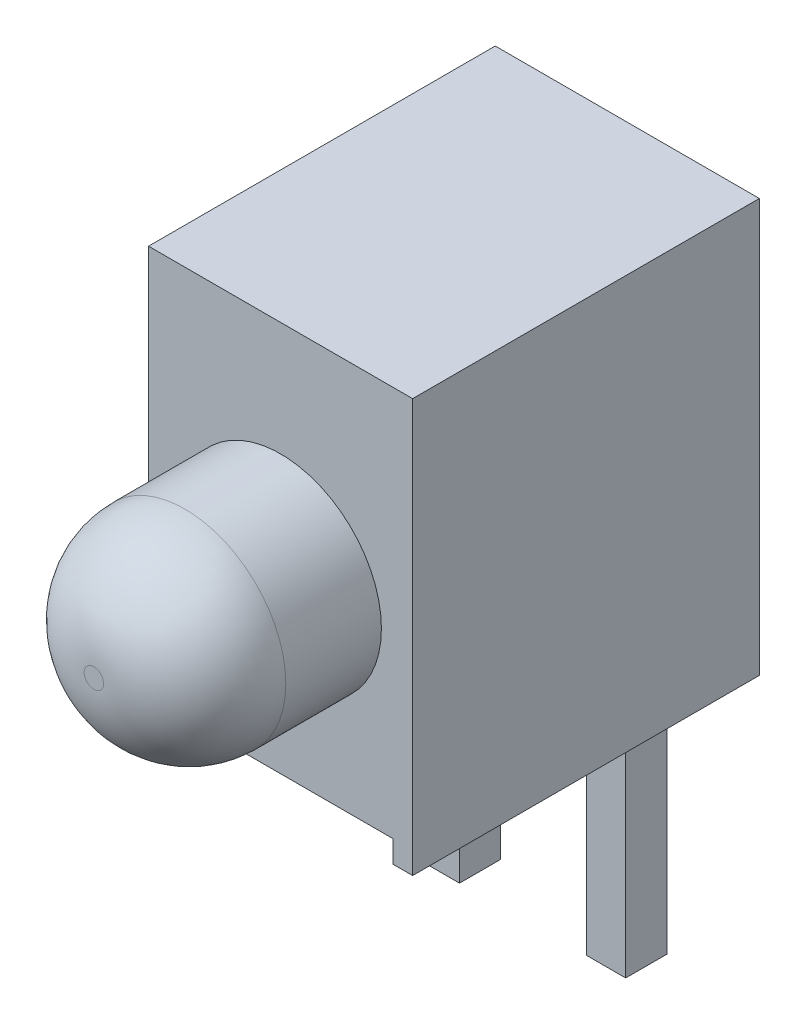
from build123d import *

# Parameters (mm, degrees)
SKETCH1_W           = 4.06
SKETCH1_H           = 5.33
BOSS_EXTRUDE1_DEPTH = 6.35
SKETCH2_R           = 1.55
BOSS_EXTRUDE2_DEPTH = 2.8702
FILLET2_R           = 1.4
SKETCH4_W           = 3.493828458
SKETCH4_H           = 0.340679683
CUT_EXTRUDE1_DEPTH  = 9.53535588
SKETCH6_W           = 0.6
SKETCH6_H           = 0.632779055
SKETCH6_H_2         = 0.632779056
BOSS_EXTRUDE5_DEPTH = 3.81


with BuildPart() as part:
    # Sketch1 → Boss-Extrude1 (new body)
    with BuildSketch(Plane(origin=(0, 0, 0), x_dir=(1, 0, 0), z_dir=(0, 1, 0))):
        Rectangle(SKETCH1_W, SKETCH1_H)
    extrude(amount=BOSS_EXTRUDE1_DEPTH)

    # Sketch2 → Boss-Extrude2 (add)
    with BuildSketch(Plane.XY.offset(2.665)):
        with Locations((0, 3.05)):
            Circle(SKETCH2_R)
    extrude(amount=BOSS_EXTRUDE2_DEPTH)

    # Fillet2
    fillet2_edges = [part.edges().sort_by_distance(p)[0] for p in [
        (-1.55, 3.05, 5.5352),
    ]]
    fillet(fillet2_edges, radius=FILLET2_R)

    # Sketch4 → Cut-Extrude1 (cut, through all)
    with BuildSketch(Plane.XY.offset(2.665)):
        with Locations((-0.015737966, 0.170339842)):
            Rectangle(SKETCH4_W, SKETCH4_H)
    extrude(amount=-CUT_EXTRUDE1_DEPTH, mode=Mode.SUBTRACT)

    # Sketch6 → Boss-Extrude5 (add)
    with BuildSketch(Plane.XZ.offset(-0.340679683)):
        with Locations((-1.278193782, -1.380000213)):
            Rectangle(SKETCH6_W, SKETCH6_H)
        with Locations((1.261806218, -1.395)):
            Rectangle(SKETCH6_W, SKETCH6_H_2)
    extrude(amount=BOSS_EXTRUDE5_DEPTH)


solid = part.part
